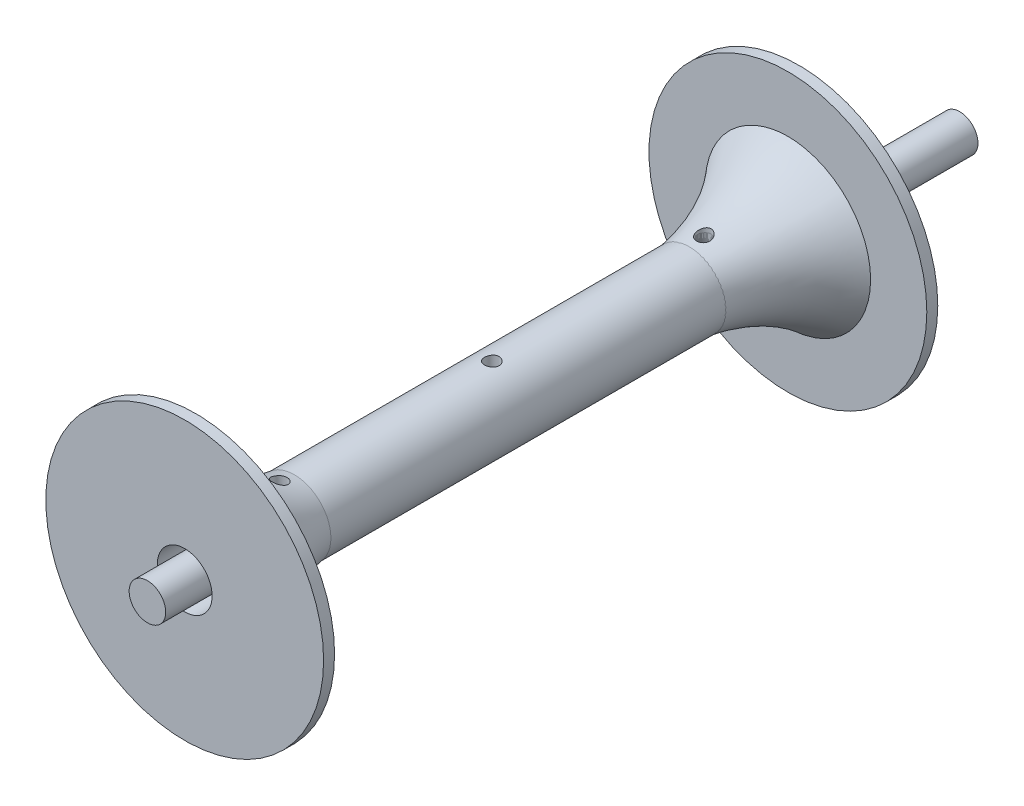
from build123d import *

# Parameters (mm, degrees)
SKETCH1_R               = 6.35
BOSS_EXTRUDE1_DEPTH     = 282.194
SKETCH15_W              = 3.81
SKETCH15_H              = 25.4
SKETCH8_R               = 12.7
BOSS_EXTRUDE2_DEPTH     = 184.658
CUT_EXTRUDE1_DEPTH      = 291.32999989
CUT_EXTRUDE1_DEPTH_BACK = 291.32999989
SKETCH16_R              = 2.54


with BuildPart() as part:
    # Sketch1 → Boss-Extrude1 (new body)
    with BuildSketch(Plane.XY):
        Circle(SKETCH1_R)
    extrude(amount=BOSS_EXTRUDE1_DEPTH)


with BuildPart() as body_2:
    # Sketch14 → Revolve1 (revolve)
    with BuildSketch(Plane(origin=(0, 0, 0), x_dir=(0, 0, -1), z_dir=(1, 0, 0))):
        with BuildLine():
            Line((-106.68, 9.525), (-55.88, 9.525))
            Line((-55.88, 9.525), (-55.88, 32.385))
            ThreePointArc((-55.88, 32.385), (-79.076676753, 16.716691883), (-106.68, 12.065))
            Line((-106.68, 12.065), (-106.68, 9.525))
        make_face()
    revolve1 = revolve(axis=Axis((0, 0, 282.194), (0, 0, -1)))


with BuildPart() as body_3:
    # Sketch15 → Revolve2 (revolve)
    with BuildSketch(Plane(origin=(0, 0, 0), x_dir=(0, 0, -1), z_dir=(1, 0, 0))):
        with Locations((-57.785, 35.56)):
            Rectangle(SKETCH15_W, SKETCH15_H)
    revolve2 = revolve(axis=Axis((0, 0, 282.194), (0, 0, -1)))


with BuildPart() as body_4:
    # Sketch8 → Boss-Extrude2 (new body)
    with BuildSketch(Plane(origin=(0, 0, 55.88), x_dir=(-1, 0, 0), z_dir=(0, 0, -1))):
        Circle(SKETCH8_R)
    extrude(amount=-BOSS_EXTRUDE2_DEPTH)

    # Mirror6: Revolve1, Revolve2 across plane
    add(revolve1.mirror(Plane(origin=(0, 0, 162.56), x_dir=(1, 0, 0), z_dir=(0, 0, -1))))
    add(revolve2.mirror(Plane(origin=(0, 0, 162.56), x_dir=(1, 0, 0), z_dir=(0, 0, -1))))


with BuildPart() as cut_extrude1_tool:
    # Sketch16 → Cut-Extrude1 (new, two sides: drawn at the far end of the back side and taken through both)
    with BuildSketch(Plane(origin=(0, 0, 0), x_dir=(1, 0, 0), z_dir=(0, 1, 0)).offset(-CUT_EXTRUDE1_DEPTH_BACK)):
        with Locations((0, -88.9)):
            Circle(SKETCH16_R)
        with Locations((0, -162.56)):
            Circle(SKETCH16_R)
        with Locations((0, -236.22)):
            Circle(SKETCH16_R)
    extrude(amount=CUT_EXTRUDE1_DEPTH + CUT_EXTRUDE1_DEPTH_BACK)


with BuildPart() as part_1:
    add(part.part)

    # Cut-Extrude1: cut by cut_extrude1_tool
    add(cut_extrude1_tool.part, mode=Mode.SUBTRACT)


with BuildPart() as body_2_1:
    add(body_2.part)

    # Cut-Extrude1: cut by cut_extrude1_tool
    add(cut_extrude1_tool.part, mode=Mode.SUBTRACT)


with BuildPart() as body_4_1:
    add(body_4.part)

    # Cut-Extrude1: cut by cut_extrude1_tool
    add(cut_extrude1_tool.part, mode=Mode.SUBTRACT)


solid = Compound([body_3.part, part_1.part, body_2_1.part, body_4_1.part])
